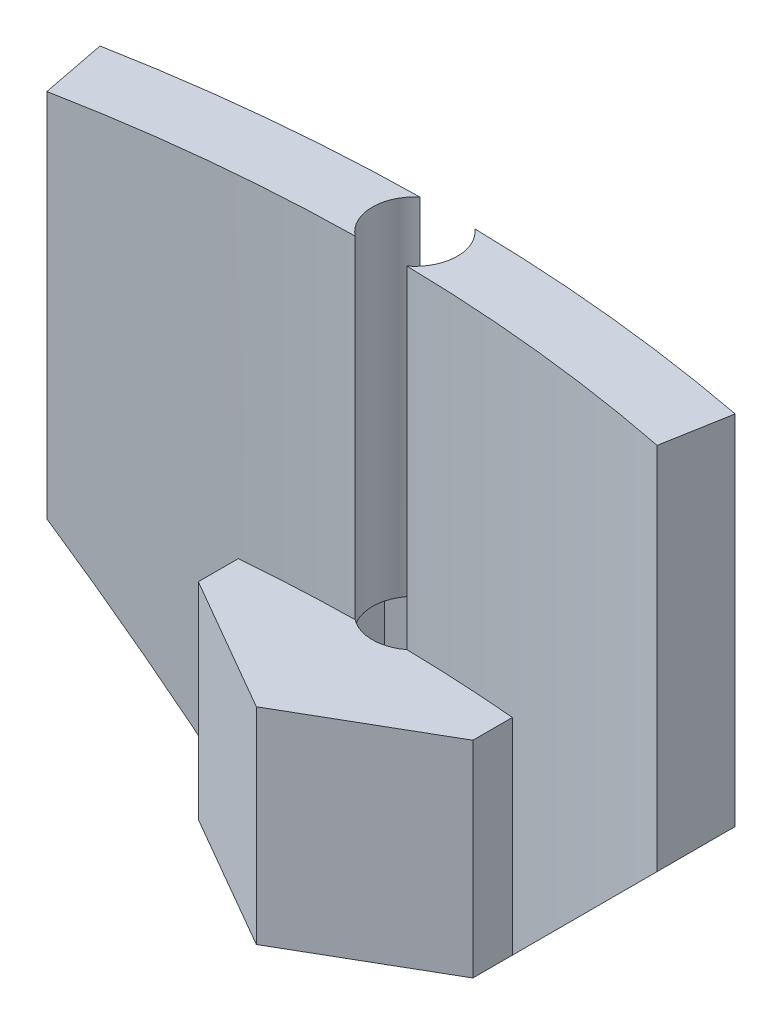
from build123d import *

# Parameters (mm, degrees)
BOSS_EXTRUDE1_DEPTH     = 7
BOSS_EXTRUDE3_DEPTH     = 15
BOSS_EXTRUDE4_DEPTH     = 1
CUT_EXTRUDE1_DEPTH      = 33.699933964
CUT_EXTRUDE1_DEPTH_BACK = 33.699933964
SKETCH2_R               = 3.1
BOSS_EXTRUDE5_DEPTH     = 17.2
CUT_EXTRUDE3_DEPTH      = 37.841358298
CUT_EXTRUDE3_DEPTH_BACK = 37.841358298
CHAMFER1_SIZE           = 15


with BuildPart() as part:
    # Sketch1 → Boss-Extrude1 (new body)
    with BuildSketch(Plane(origin=(0, 0, 0), x_dir=(1, 0, 0), z_dir=(0, 1, 0))):
        with BuildLine():
            Line((-26.590677944, 0.897790933), (-24.677260394, -3.721607667))
            ThreePointArc((-24.677260394, -3.721607667), (-0.012479526, -1.099035349), (24.643498383, -3.80311637))
            Line((24.643498383, -3.80311637), (26.537632348, 0.769727537))
            ThreePointArc((26.537632348, 0.769727537), (26.536056466, 0.805424146), (26.507677261, 0.827134789))
            ThreePointArc((26.507677261, 0.827134789), (-0.03768972, 3.726158505), (-26.590677944, 0.897790933))
        make_face()
    extrude(amount=BOSS_EXTRUDE1_DEPTH)

    # Sketch1<4> → Boss-Extrude3 (add)
    with BuildSketch(Plane(origin=(0, 0, 0), x_dir=(1, 0, 0), z_dir=(0, 1, 0))):
        Polygon((0, 12.892692804), (-10, 7.119190112), (-10, -4.427815272), (0, -10.201317964), (10, -4.427815272), (10, 7.119190112), align=None)
        Polygon((0, 7.407865247), (-5.25, 4.376776333), (-5.25, -1.685401493), (0, -4.716490406), (5.25, -1.685401493), (5.25, 4.376776333), align=None, mode=Mode.SUBTRACT)
    extrude(amount=-BOSS_EXTRUDE3_DEPTH)

    # Sketch1<5> → Boss-Extrude4 (add)
    with BuildSketch(Plane(origin=(0, 0, 0), x_dir=(1, 0, 0), z_dir=(0, 1, 0))):
        Polygon((0, 12.892692804), (-10, 7.119190112), (-10, -4.427815272), (0, -10.201317964), (10, -4.427815272), (10, 7.119190112), align=None)
    extrude(amount=-BOSS_EXTRUDE4_DEPTH)

    # Sketch2 → Cut-Extrude1 (cut, two sides: drawn at the far end of the back side and taken through both)
    with BuildSketch(Plane.XZ.offset(1).offset(-CUT_EXTRUDE1_DEPTH_BACK)):
        with Locations(Location((0, -1.34568742, 0), (0, 0, 229.79522624))):
            Circle(SKETCH2_R)
    extrude(amount=CUT_EXTRUDE1_DEPTH + CUT_EXTRUDE1_DEPTH_BACK, mode=Mode.SUBTRACT)

    # Sketch3 → Boss-Extrude5 (add)
    with BuildSketch(Plane(origin=(0, 7, 0), x_dir=(1, 0, 0), z_dir=(0, 1, 0))):
        with BuildLine():
            ThreePointArc((-1.890425019, -1.111199481), (-12.112919314, -1.714534324), (-22.241796383, -3.220937936))
            Line((-22.241796383, -3.220937936), (-23.176627213, 1.588349763))
            ThreePointArc((-23.176627213, 1.588349763), (-12.634359148, 3.104112575), (-2.001116102, 3.713288389))
            ThreePointArc((-2.001116102, 3.713288389), (-3.099184389, 1.274580997), (-1.890425019, -1.111199481))
        make_face()
        with BuildLine():
            Line((22.31208714, -3.314700634), (23.163482432, 1.513802008))
            ThreePointArc((23.163482432, 1.513802008), (22.130674577, 1.706638646), (21.096276164, 1.890752624))
            ThreePointArc((21.096276164, 1.890752624), (11.587641271, 3.166667106), (2.008990202, 3.706610623))
            ThreePointArc((2.008990202, 3.706610623), (3.098925579, 1.264077023), (1.881941585, -1.117703712))
            ThreePointArc((1.881941585, -1.117703712), (12.145968264, -1.760973798), (22.31208714, -3.314700634))
        make_face()
    extrude(amount=BOSS_EXTRUDE5_DEPTH)

    # Sketch4 → Cut-Extrude3 (cut, two sides: drawn at the far end of the back side and taken through both)
    with BuildSketch(Plane(origin=(0, 7, 0), x_dir=(1, 0, 0), z_dir=(0, 1, 0)).offset(-CUT_EXTRUDE3_DEPTH_BACK)):
        with BuildLine():
            Line((23.163482432, 1.513802008), (22.31208714, -3.314700634))
            ThreePointArc((22.31208714, -3.314700634), (23.479051904, -3.552898091), (24.643498383, -3.80311637))
            Line((24.643498383, -3.80311637), (26.537632348, 0.769727537))
            ThreePointArc((26.537632348, 0.769727537), (26.536056466, 0.805424146), (26.507677261, 0.827134789))
            ThreePointArc((26.507677261, 0.827134789), (24.837933629, 1.181931749), (23.163482432, 1.513802008))
        make_face()
        with BuildLine():
            Line((-22.241796383, -3.220937936), (-23.176627213, 1.588349763))
            ThreePointArc((-23.176627213, 1.588349763), (-24.886067704, 1.255010478), (-26.590677944, 0.897790933))
            Line((-26.590677944, 0.897790933), (-24.677260394, -3.721607667))
            ThreePointArc((-24.677260394, -3.721607667), (-23.460875681, -3.464719015), (-22.241796383, -3.220937936))
        make_face()
    extrude(amount=CUT_EXTRUDE3_DEPTH + CUT_EXTRUDE3_DEPTH_BACK, mode=Mode.SUBTRACT)

    # Chamfer1
    # the kernel refuses this chamfer: 15 mm, written as the material it adds along each edge
    with BuildSketch(Plane(origin=(10, 0, 40.125691349), x_dir=(0.9996219169112966, 0.027495876610586365, 0), z_dir=(0, 0, -1))) as chamfer1_piece_1_section:
        Polygon((CHAMFER1_SIZE * 0.999621916911, CHAMFER1_SIZE * 0.0274958766106), (-CHAMFER1_SIZE * 0.0274958766106, CHAMFER1_SIZE * 0.999621916911), (0, 0), align=None)
    chamfer1_piece_1 = extrude(amount=82.008394033, mode=Mode.PRIVATE)
    chamfer1_piece_1 = chamfer1_piece_1 - Plane(origin=(-0.203357417, -3.100629743, 116.598877624), x_dir=(-0.21189526386996682, 0, -0.9772923805849901), z_dir=(0, -1, 0)) * Cylinder(115.5, 224, mode=Mode.PRIVATE)
    chamfer1_piece_1 = split(chamfer1_piece_1, bisect_by=Plane(origin=(22.567978143, -3.100629743, 1.863470638), z_dir=(-0.9848077530122092, 0, -0.17364817766692403)), keep=Keep.TOP, mode=Mode.PRIVATE)
    chamfer1_piece_1 = chamfer1_piece_1 & Plane(origin=(-0.203357417, -3.100629743, 120.773731271), x_dir=(0.21454646327949964, 0, -0.9767137836102542), z_dir=(0, -1, 0)) * Cylinder(124.5, 224, mode=Mode.PRIVATE)
    add(chamfer1_piece_1)
    with BuildSketch(Plane(origin=(-10, 0, -41.915476478), x_dir=(0.02749587661058632, -0.9996219169112968, 0), z_dir=(0, 0, 1))) as chamfer1_piece_2_section:
        Polygon((CHAMFER1_SIZE * 0.999621916911, -CHAMFER1_SIZE * 0.0274958766106), (-CHAMFER1_SIZE * 0.0274958766106, -CHAMFER1_SIZE * 0.999621916911), (0, 0), align=None)
    chamfer1_piece_2 = extrude(amount=82.005821637, mode=Mode.PRIVATE)
    chamfer1_piece_2 = chamfer1_piece_2 & Plane(origin=(-0.203357417, -2.670719626, 120.773731271), x_dir=(0.21454646327949964, 0, -0.9767137836102542), z_dir=(0, -1, 0)) * Cylinder(124.5, 224, mode=Mode.PRIVATE)
    chamfer1_piece_2 = chamfer1_piece_2 - Plane(origin=(-0.203357417, -2.670719626, 116.598877624), x_dir=(-0.21189526386996682, 0, -0.9772923805849901), z_dir=(0, -1, 0)) * Cylinder(115.5, 224, mode=Mode.PRIVATE)
    chamfer1_piece_2 = split(chamfer1_piece_2, bisect_by=Plane(origin=(-23.112985585, -2.670719626, -1.260941971), z_dir=(0.9816271834476646, 0, -0.1908089953765415)), keep=Keep.TOP, mode=Mode.PRIVATE)
    add(chamfer1_piece_2)


solid = part.part
